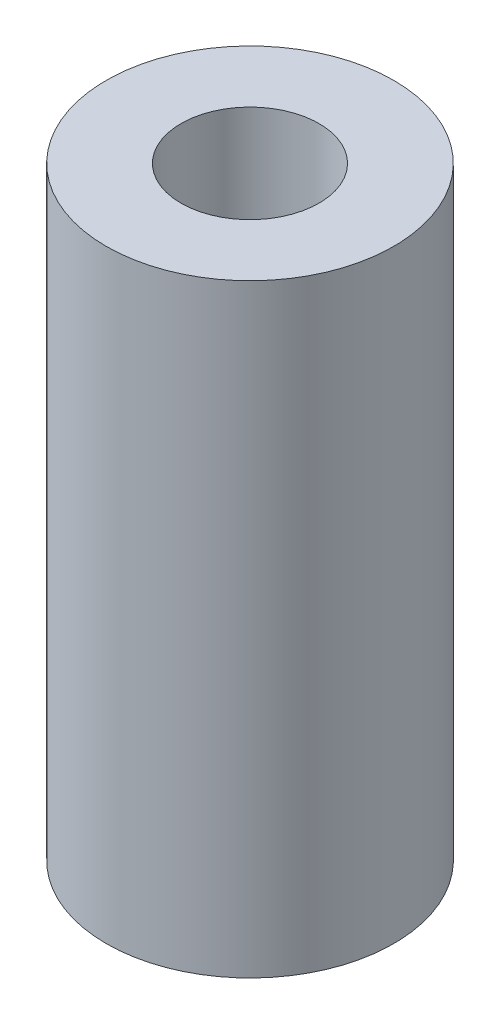
from build123d import *

# Parameters (mm, degrees)
SKETCH1_R            = 2.5
BOSS_EXTRUDE1_DEPTH  = 5.25
M2_CLEARANCE_HOLE1_D = 2.4


with BuildPart() as part:
    # Sketch1 → Boss-Extrude1 (new, symmetric)
    with BuildSketch(Plane(origin=(0, 0, 0), x_dir=(1, 0, 0), z_dir=(0, 1, 0))):
        Circle(SKETCH1_R)
    extrude(amount=BOSS_EXTRUDE1_DEPTH, both=True)

    # M2 Clearance Hole1 (through all)
    with Locations(Plane(origin=(0, 5.25, 0), x_dir=(1, 0, 0), z_dir=(0, 1, 0))):
        with Locations((0, 0)):
            Hole(M2_CLEARANCE_HOLE1_D / 2)


solid = part.part
